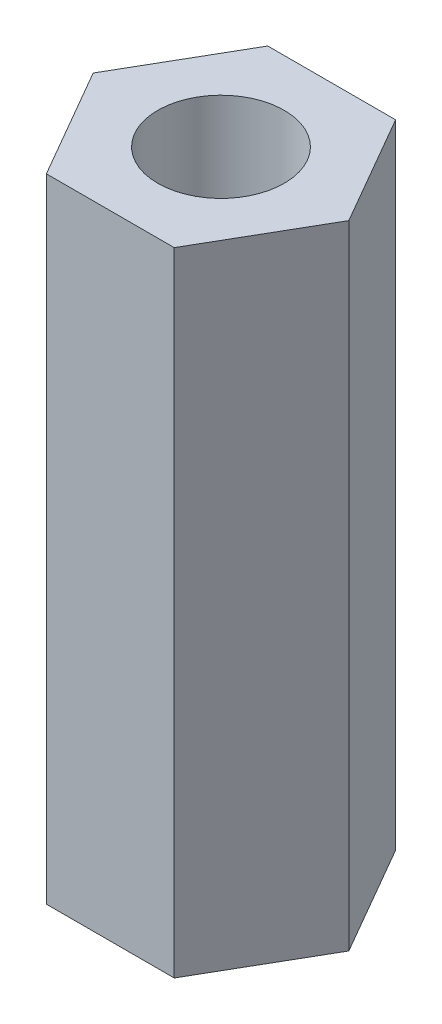
from build123d import *

# Parameters (mm, degrees)
SKETCH1_R           = 2
BOSS_EXTRUDE1_DEPTH = 20


with BuildPart() as part:
    # Sketch1 → Boss-Extrude1 (new body)
    with BuildSketch(Plane(origin=(0, 0, 0), x_dir=(1, 0, 0), z_dir=(0, 1, 0))):
        Polygon((2.020725942, 3.5), (-2.020725942, 3.5), (-4.041451884, 0), (-2.020725942, -3.5), (2.020725942, -3.5), (4.041451884, 0), align=None)
        Circle(SKETCH1_R, mode=Mode.SUBTRACT)
    extrude(amount=BOSS_EXTRUDE1_DEPTH)


solid = part.part
